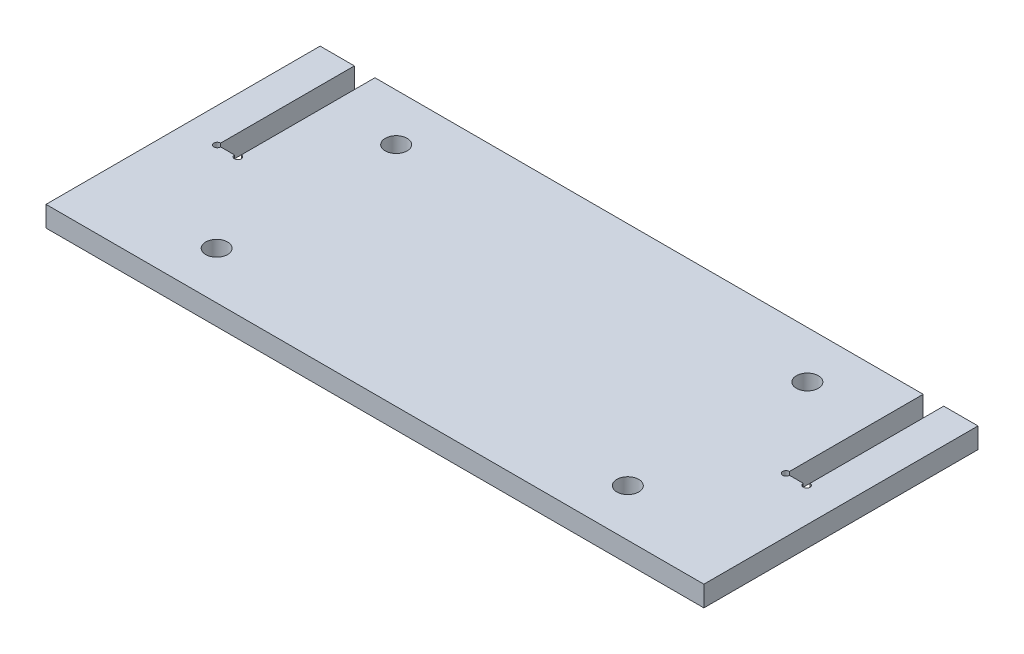
from build123d import *

# Parameters (mm, degrees)
SKETCH1_R           = 1.6
BOSS_EXTRUDE1_DEPTH = 3
SKETCH2_R           = 0.5
CUT_EXTRUDE1_DEPTH  = 53.086466572


with BuildPart() as part:
    # Sketch1 → Boss-Extrude1 (new body)
    with BuildSketch(Plane(origin=(0, 0, 0), x_dir=(1, 0, 0), z_dir=(0, 1, 0))):
        Polygon((-48, -20), (48, -20), (48, 20), (43, 20), (43, 0), (40, 0), (40, 20), (-40, 20), (-40, 0), (-43, 0), (-43, 20), (-48, 20), align=None)
        with Locations((-30, 13.1)):
            Circle(SKETCH1_R, mode=Mode.SUBTRACT)
        with Locations((30, 13.1)):
            Circle(SKETCH1_R, mode=Mode.SUBTRACT)
        with Locations((30, -13.1)):
            Circle(SKETCH1_R, mode=Mode.SUBTRACT)
        with Locations((-30, -13.1)):
            Circle(SKETCH1_R, mode=Mode.SUBTRACT)
    extrude(amount=BOSS_EXTRUDE1_DEPTH)

    # Sketch2 → Cut-Extrude1 (cut, through all)
    with BuildSketch(Plane(origin=(0, 3, 0), x_dir=(1, 0, 0), z_dir=(0, 1, 0))):
        with Locations((-43, 0)):
            Circle(SKETCH2_R)
        with Locations((-40, 0)):
            Circle(SKETCH2_R)
        with Locations((40, 0)):
            Circle(SKETCH2_R)
        with Locations((43, 0)):
            Circle(SKETCH2_R)
    extrude(amount=-CUT_EXTRUDE1_DEPTH, mode=Mode.SUBTRACT)


solid = part.part
